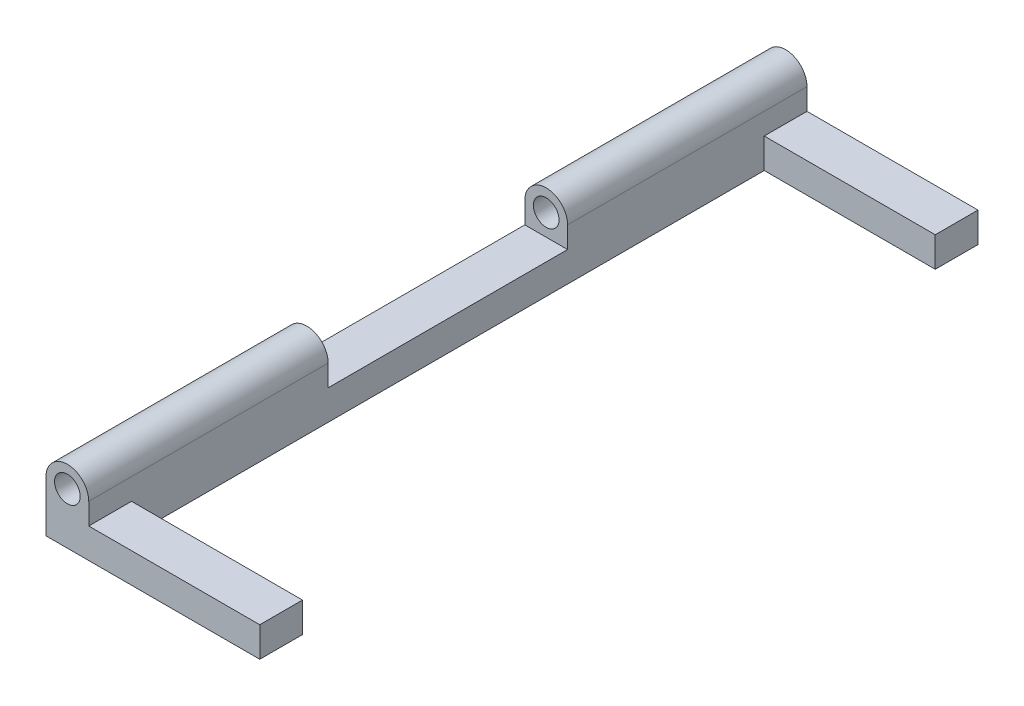
from build123d import *

# Parameters (mm, degrees)
SKETCH1_R               = 0.75
BOSS_EXTRUDE1_DEPTH     = 42
CUT_EXTRUDE1_DEPTH      = 43.134923075
CUT_EXTRUDE1_DEPTH_BACK = 43.134923075
SKETCH2_W               = 14
SKETCH2_H               = 2.5
SKETCH3_W               = 2.5
SKETCH3_H               = 1.75
BOSS_EXTRUDE2_DEPTH     = 10


with BuildPart() as part:
    # Sketch1 → Boss-Extrude1 (new body)
    with BuildSketch(Plane.XY):
        with BuildLine():
            Line((-1.25, -0.128776519), (-1.25, -3.128776519))
            Line((-1.25, -3.128776519), (1.25, -3.128776519))
            Line((1.25, -3.128776519), (1.25, -0.128776519))
            ThreePointArc((1.25, -0.128776519), (0, 1.121223481), (-1.25, -0.128776519))
        make_face()
        with Locations((0, -0.128776519)):
            Circle(SKETCH1_R, mode=Mode.SUBTRACT)
    extrude(amount=BOSS_EXTRUDE1_DEPTH)

    # Sketch2 → Cut-Extrude1 (cut, two sides: drawn at the far end of the back side and taken through both)
    with BuildSketch(Plane(origin=(0, 0, 0), x_dir=(0, 0, -1), z_dir=(1, 0, 0)).offset(-CUT_EXTRUDE1_DEPTH_BACK)):
        with Locations((-21, -0.128776519)):
            Rectangle(SKETCH2_W, SKETCH2_H)
    extrude(amount=CUT_EXTRUDE1_DEPTH + CUT_EXTRUDE1_DEPTH_BACK, mode=Mode.SUBTRACT)

    # Sketch3 → Boss-Extrude2 (add)
    with BuildSketch(Plane(origin=(1.25, 0, 0), x_dir=(0, 0, -1), z_dir=(1, 0, 0))):
        with Locations((-40.75, -2.253776519)):
            Rectangle(SKETCH3_W, SKETCH3_H)
        with Locations((-1.25, -2.253776519)):
            Rectangle(SKETCH3_W, SKETCH3_H)
    extrude(amount=BOSS_EXTRUDE2_DEPTH)


solid = part.part
